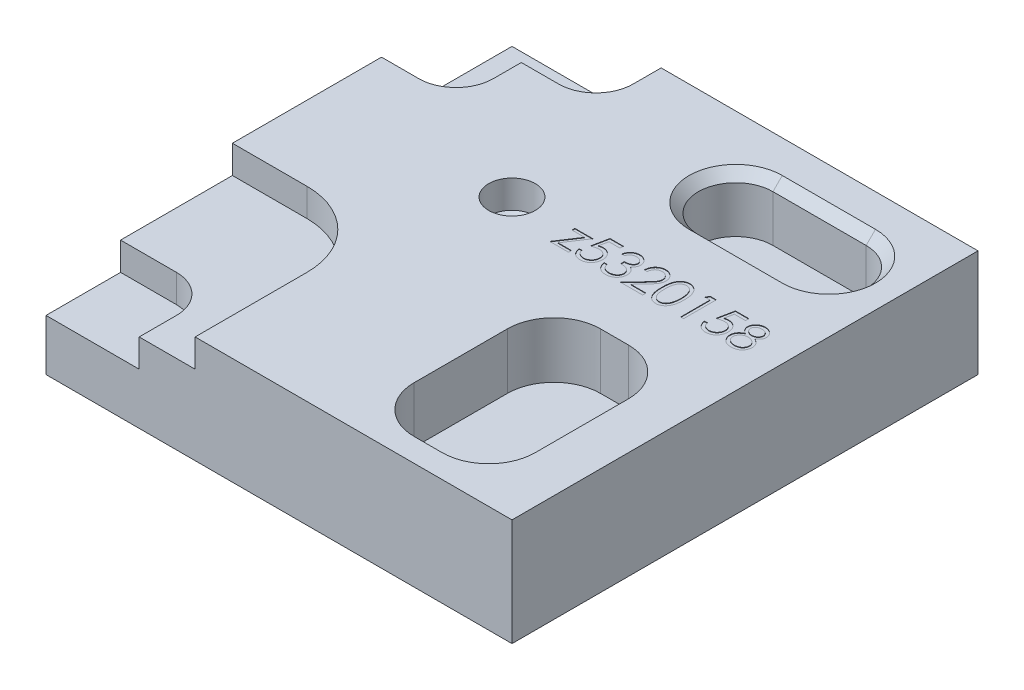
from build123d import *

# Parameters (mm, degrees)
SKETCH1_W                       = 50
SKETCH1_H                       = 50
BOSS_EXTRUDE1_DEPTH             = 11.5
CUT_EXTRUDE1_DEPTH              = 3
CUT_EXTRUDE4_DEPTH              = 43.99702731
CUT_EXTRUDE4_DEPTH_BACK         = 3
CUT_EXTRUDE5_DEPTH              = 6
CUT_EXTRUDE8_DEPTH              = 6
CUT_EXTRUDE11_DEPTH             = 44.689178952
CUT_EXTRUDE11_DEPTH_BACK        = 6
CHAMFER1_SIZE                   = 1
F_3_0MM_DOWEL_HOLE1_D           = 3
F_3_0MM_DOWEL_HOLE1_DEPTH       = 6
F_3_0MM_DOWEL_HOLE1_CSINK_D     = 3.05
F_3_0MM_DOWEL_HOLE1_CSINK_ANGLE = 90
F_3_0MM_DOWEL_HOLE1_TIP         = 0.901290929
F_5_0MM_DOWEL_HOLE1_D           = 5
F_5_0MM_DOWEL_HOLE1_DEPTH       = 3
F_5_0MM_DOWEL_HOLE1_TIP         = 1.502151548
ENGRAVE_CUT_DEPTH               = 0.05


with BuildPart() as part:
    # Sketch1 → Boss-Extrude1 (new body)
    with BuildSketch(Plane(origin=(0, 0, 0), x_dir=(1, 0, 0), z_dir=(0, 1, 0))):
        with Locations((4.357016401, -5.243345475)):
            Rectangle(SKETCH1_W, SKETCH1_H)
    extrude(amount=BOSS_EXTRUDE1_DEPTH)

    # Sketch3 → Cut-Extrude1 (cut)
    with BuildSketch(Plane(origin=(0, 11.5, 0), x_dir=(1, 0, 0), z_dir=(0, 1, 0))):
        with BuildLine():
            Line((-20.642983599, -10.243345475), (-12.642983599, -10.243345475))
            ThreePointArc((-12.642983599, -10.243345475), (-6.986129349, -12.586491226), (-4.642983599, -18.243345475))
            Line((-4.642983599, -18.243345475), (-4.642983599, -30.243345475))
            Line((-4.642983599, -30.243345475), (-20.642983599, -30.243345475))
            Line((-20.642983599, -30.243345475), (-20.642983599, -10.243345475))
        make_face()
    extrude(amount=-CUT_EXTRUDE1_DEPTH, mode=Mode.SUBTRACT)

    # Sketch7 → Cut-Extrude4 (cut, two sides: drawn at the far end of the back side and taken through both)
    with BuildSketch(Plane(origin=(0, 8.5, 0), x_dir=(1, 0, 0), z_dir=(0, 1, 0)).offset(-CUT_EXTRUDE4_DEPTH_BACK)):
        with BuildLine():
            Line((-161.241605337, -22.243345475), (-20.642983599, -22.243345475))
            Line((-20.642983599, -22.243345475), (-14.642983599, -22.243345475))
            ThreePointArc((-14.642983599, -22.243345475), (-11.814556474, -23.41491835), (-10.642983599, -26.243345475))
            Line((-10.642983599, -26.243345475), (-10.642983599, -30.243345475))
            Line((-10.642983599, -30.243345475), (-10.642983599, -170.841967214))
            Line((-10.642983599, -170.841967214), (-208.145915739, -371.003106137))
            Line((-208.145915739, -371.003106137), (-358.744537477, -222.404484399))
            Line((-358.744537477, -222.404484399), (-161.241605337, -22.243345475))
        make_face()
    extrude(amount=CUT_EXTRUDE4_DEPTH + CUT_EXTRUDE4_DEPTH_BACK, mode=Mode.SUBTRACT)

    # Sketch8 → Cut-Extrude5 (cut)
    with BuildSketch(Plane(origin=(0, 11.5, 0), x_dir=(1, 0, 0), z_dir=(0, 1, 0))):
        with BuildLine():
            Line((16.357016401, -7.743345475), (19.357016401, -7.743345475))
            ThreePointArc((19.357016401, -7.743345475), (22.892550307, -9.207811569), (24.357016401, -12.743345475))
            Line((24.357016401, -12.743345475), (24.357016401, -22.743345475))
            ThreePointArc((24.357016401, -22.743345475), (22.892550307, -26.278879381), (19.357016401, -27.743345475))
            Line((19.357016401, -27.743345475), (16.357016401, -27.743345475))
            ThreePointArc((16.357016401, -27.743345475), (12.821482495, -26.278879381), (11.357016401, -22.743345475))
            Line((11.357016401, -22.743345475), (11.357016401, -12.743345475))
            ThreePointArc((11.357016401, -12.743345475), (12.821482495, -9.207811569), (16.357016401, -7.743345475))
        make_face()
    extrude(amount=-CUT_EXTRUDE5_DEPTH, mode=Mode.SUBTRACT)

    # Sketch11 → Cut-Extrude8 (cut)
    with BuildSketch(Plane(origin=(0, 11.5, 0), x_dir=(1, 0, 0), z_dir=(0, 1, 0))):
        with BuildLine():
            Line((11.857016401, 15.256654525), (21.857016401, 15.256654525))
            ThreePointArc((21.857016401, 15.256654525), (25.857016401, 11.256654525), (21.857016401, 7.256654525))
            Line((21.857016401, 7.256654525), (11.857016401, 7.256654525))
            ThreePointArc((11.857016401, 7.256654525), (7.857016401, 11.256654525), (11.857016401, 15.256654525))
        make_face()
    extrude(amount=-CUT_EXTRUDE8_DEPTH, mode=Mode.SUBTRACT)

    # Sketch12 → Cut-Extrude11 (cut, two sides: drawn at the far end of the back side and taken through both)
    with BuildSketch(Plane(origin=(0, 11.5, 0), x_dir=(1, 0, 0), z_dir=(0, 1, 0)).offset(-CUT_EXTRUDE11_DEPTH_BACK)):
        with BuildLine():
            Line((-153.866358005, 5.756654525), (-20.642983599, 5.756654525))
            Line((-20.642983599, 5.756654525), (-16.642983599, 5.756654525))
            ThreePointArc((-16.642983599, 5.756654525), (-13.814556474, 6.9282274), (-12.642983599, 9.756654525))
            Line((-12.642983599, 9.756654525), (-12.642983599, 12.756654525))
            Line((-12.642983599, 12.756654525), (-8.642983599, 12.756654525))
            ThreePointArc((-8.642983599, 12.756654525), (-5.814556474, 13.9282274), (-4.642983599, 16.756654525))
            Line((-4.642983599, 16.756654525), (-4.642983599, 19.756654525))
            Line((-4.642983599, 19.756654525), (-4.642983599, 152.980028931))
            Line((-4.642983599, 152.980028931), (-191.773930696, 342.653112395))
            Line((-191.773930696, 342.653112395), (-340.997305102, 195.429737989))
            Line((-340.997305102, 195.429737989), (-153.866358005, 5.756654525))
        make_face()
    extrude(amount=CUT_EXTRUDE11_DEPTH + CUT_EXTRUDE11_DEPTH_BACK, mode=Mode.SUBTRACT)

    # Chamfer1
    chamfer1_edges = [part.edges().sort_by_distance(p)[0] for p in [
        (7.857016401, 11.5, -11.256654525),
        (16.857016401, 11.5, -7.256654525),
        (25.857016401, 11.5, -11.256654525),
        (16.857016401, 11.5, -15.256654525),
    ]]
    chamfer(chamfer1_edges, length=CHAMFER1_SIZE)

    # Ø3.0mm Dowel Hole1
    with Locations(Plane(origin=(-0.642983599, 11.5, 0.243345475), x_dir=(0, 0, 1), z_dir=(0, 1, 0))):
        with Locations((0, 0)):
            CounterSinkHole(F_3_0MM_DOWEL_HOLE1_D / 2, F_3_0MM_DOWEL_HOLE1_CSINK_D / 2, depth=F_3_0MM_DOWEL_HOLE1_DEPTH, counter_sink_angle=F_3_0MM_DOWEL_HOLE1_CSINK_ANGLE)
            with Locations((0, 0, -(F_3_0MM_DOWEL_HOLE1_DEPTH + F_3_0MM_DOWEL_HOLE1_TIP / 2))):  # 118° drill point
                Cone(0, F_3_0MM_DOWEL_HOLE1_D / 2, F_3_0MM_DOWEL_HOLE1_TIP, mode=Mode.SUBTRACT)

    # Ø5.0mm Dowel Hole1
    with Locations(Plane(origin=(-0.642983599, 11.5, 0.243345475), x_dir=(0, 0, 1), z_dir=(0, 1, 0))):
        with Locations((0, 0)):
            Hole(F_5_0MM_DOWEL_HOLE1_D / 2, depth=F_5_0MM_DOWEL_HOLE1_DEPTH)
            with Locations((0, 0, -(F_5_0MM_DOWEL_HOLE1_DEPTH + F_5_0MM_DOWEL_HOLE1_TIP / 2))):  # 118° drill point
                Cone(0, F_5_0MM_DOWEL_HOLE1_D / 2, F_5_0MM_DOWEL_HOLE1_TIP, mode=Mode.SUBTRACT)

    # Engrave → Engrave cut (cut)
    # profile 1 of 8: a face of its own
    with BuildSketch(Plane(origin=(0, 11.5, 0), x_dir=(1, 0, 0), z_dir=(0, 1, 0))):
        Polygon((5.641411131, 0.217706349), (7.570898311, 0.217706349), (6.083117862, -2.025883395), (7.526026516, -2.025883395), (7.526026516, -2.339985959), (5.506795747, -2.339985959), (6.995277317, -0.096396215), (5.641411131, -0.096396215), align=None)
    # profile 2 of 8: a face of its own
    with BuildSketch(Plane(origin=(0, 11.5, 0), x_dir=(1, 0, 0), z_dir=(0, 1, 0))):
        with BuildLine():
            Line((9.904231644, 1.160014041), (9.904231644, 0.801039682))
            Line((9.904231644, 0.801039682), (8.713726837, 0.801039682))
            Line((8.713726837, 0.801039682), (8.525125074, -0.119533234))
            add(Edge.make_bspline(
                [(8.525125074, -0.119533234), (8.562180948, -0.109302963), (8.633970844, -0.089483429), (8.739930705, -0.067477659), (8.840522908, -0.054212214), (8.905798279, -0.052400904), (8.937384689, -0.05152442)],
                knots=[0, 0, 0, 0, 1.100273476, 2.13160584, 3.095893838, 4, 4, 4, 4], degree=3))
            add(Edge.make_bspline(
                [(8.937384689, -0.05152442), (8.976468429, -0.052370356), (9.053316826, -0.054033677), (9.165755773, -0.070005526), (9.273088666, -0.095145441), (9.375091037, -0.130265963), (9.471951587, -0.175175696), (9.562779149, -0.231275636), (9.648937062, -0.296808967), (9.728879656, -0.372153979), (9.801403964, -0.455075596), (9.865169953, -0.544233467), (9.919332544, -0.638761129), (9.962893299, -0.739561738), (9.997677633, -0.845520891), (10.020829628, -0.957753474), (10.036246337, -1.075201594), (10.037968723, -1.155506164), (10.038847029, -1.196456311)],
                knots=[0, 0, 0, 0, 1.052922333, 2.070308379, 3.05430497, 4.020497103, 4.973039431, 5.925935799, 6.892292201, 7.88610001, 8.88166317, 9.857072816, 10.836096531, 11.812156883, 12.81219415, 13.836441305, 14.89672472, 16, 16, 16, 16], degree=3))
            add(Edge.make_bspline(
                [(10.038847029, -1.196456311), (10.038181954, -1.224978532), (10.036860791, -1.281637519), (10.030142203, -1.36578172), (10.017206487, -1.448144553), (9.999838763, -1.528736945), (9.977296345, -1.607406317), (9.950007291, -1.684377845), (9.916611264, -1.759172452), (9.879979888, -1.832497847), (9.83873341, -1.902696354), (9.792954903, -1.96834534), (9.744589412, -2.030429622), (9.692548026, -2.088283355), (9.636347031, -2.141526373), (9.576667064, -2.190474654), (9.513984345, -2.235955985), (9.447329103, -2.27612418), (9.37818662, -2.313087136), (9.305558403, -2.343410673), (9.231097703, -2.370521201), (9.153732827, -2.392130729), (9.073639014, -2.409063284), (8.990684239, -2.420563884), (8.905303569, -2.428940322), (8.847428556, -2.429464679), (8.818193984, -2.429729548)],
                knots=[0, 0, 0, 0, 1.056347294, 2.098418968, 3.122841568, 4.141288669, 5.149314143, 6.15115421, 7.162517403, 8.180376062, 9.185164535, 10.17417709, 11.141909838, 12.097768115, 13.052685741, 14.0056014, 14.954263652, 15.917497458, 16.885230207, 17.854509472, 18.828990115, 19.81800267, 20.826176721, 21.857883937, 22.917946725, 24, 24, 24, 24], degree=3))
            add(Edge.make_bspline(
                [(8.818193984, -2.429729548), (8.783319803, -2.429038711), (8.714708973, -2.427679568), (8.614188406, -2.413461083), (8.5174738, -2.393097167), (8.425343699, -2.362460897), (8.336972435, -2.324073602), (8.253549717, -2.275557431), (8.172943941, -2.220578327), (8.098431904, -2.155697974), (8.029275791, -2.084782292), (7.967369282, -2.007824651), (7.912235705, -1.926095209), (7.864757958, -1.839197055), (7.824259937, -1.747358524), (7.792444949, -1.650235523), (7.766766594, -1.548335519), (7.755903173, -1.478182008), (7.75038549, -1.442550061)],
                knots=[0, 0, 0, 0, 1.0467383, 2.05933395, 3.04377827, 4.011590433, 4.970194871, 5.932262533, 6.905835911, 7.896367577, 8.894135286, 9.877477877, 10.858688626, 11.851381753, 12.8477658, 13.868841284, 14.917554742, 16, 16, 16, 16], degree=3))
            Line((7.75038549, -1.442550061), (8.064488054, -1.442550061))
            add(Edge.make_bspline(
                [(8.064488054, -1.442550061), (8.072216612, -1.475926514), (8.087071328, -1.540077909), (8.119677077, -1.63020925), (8.159542953, -1.710528474), (8.206947301, -1.782098057), (8.263497331, -1.844507054), (8.32802676, -1.900124116), (8.400374484, -1.950299245), (8.480767713, -1.992122013), (8.565580792, -2.027790766), (8.654348002, -2.051542461), (8.744652349, -2.068243354), (8.805730719, -2.069915115), (8.836423151, -2.07075519)],
                knots=[0, 0, 0, 0, 1.136247022, 2.183929868, 3.172523383, 4.106158343, 5.02341133, 5.958108904, 6.928429099, 7.938127109, 8.96079061, 9.975095812, 10.982467395, 12, 12, 12, 12], degree=3))
            add(Edge.make_bspline(
                [(8.836423151, -2.07075519), (8.866381595, -2.069934412), (8.925370017, -2.068318293), (9.012181404, -2.055879281), (9.095994278, -2.03672171), (9.175981635, -2.008051855), (9.253543174, -1.973207136), (9.326716945, -1.928492061), (9.397619822, -1.877032042), (9.464047956, -1.818075412), (9.524887405, -1.753105717), (9.578643526, -1.683628324), (9.623420439, -1.609511477), (9.661154548, -1.532038325), (9.689807847, -1.450359767), (9.710248828, -1.364858592), (9.722251887, -1.275323612), (9.723903067, -1.214254302), (9.724744465, -1.183134997)],
                knots=[0, 0, 0, 0, 1.027316725, 2.022795036, 3.002884548, 3.971462791, 4.93288096, 5.914575861, 6.907176829, 7.935150275, 8.956128384, 9.956726525, 10.942570165, 11.921478529, 12.907843606, 13.90538589, 14.932640048, 16, 16, 16, 16], degree=3))
            add(Edge.make_bspline(
                [(9.724744465, -1.183134997), (9.724085985, -1.155059246), (9.722797105, -1.100104957), (9.712266535, -1.01970575), (9.693949563, -0.943632708), (9.668525683, -0.871518474), (9.636246175, -0.803295031), (9.596799863, -0.738891971), (9.549446465, -0.679158138), (9.495354576, -0.624065584), (9.436096535, -0.57322071), (9.370652793, -0.529876623), (9.300392866, -0.493412705), (9.226163266, -0.461944707), (9.146198368, -0.439343962), (9.062081735, -0.422376076), (8.972905028, -0.412560714), (8.911934339, -0.411198825), (8.880593824, -0.410498779)],
                knots=[0, 0, 0, 0, 1.045622112, 2.046656509, 3.013763289, 3.955457236, 4.890082067, 5.820317437, 6.762574623, 7.722996705, 8.69280354, 9.665887285, 10.63943826, 11.638615906, 12.663482002, 13.728887084, 14.832589034, 16, 16, 16, 16], degree=3))
            add(Edge.make_bspline(
                [(8.880593824, -0.410498779), (8.853464895, -0.41107937), (8.79745054, -0.412278144), (8.711527713, -0.421104641), (8.62123599, -0.435343935), (8.526921494, -0.454930183), (8.428300986, -0.480561259), (8.325582585, -0.51127576), (8.218550319, -0.547997759), (8.146432594, -0.575729972), (8.109359849, -0.589985959)],
                knots=[0, 0, 0, 0, 0.817624296, 1.688186739, 2.600797293, 3.572016777, 4.590301741, 5.671205678, 6.80286297, 8, 8, 8, 8], degree=3))
            Line((8.109359849, -0.589985959), (8.468334208, 1.160014041))
            Line((8.468334208, 1.160014041), (9.904231644, 1.160014041))
        make_face()
    # profile 3 of 8: a face of its own
    with BuildSketch(Plane(origin=(0, 11.5, 0), x_dir=(1, 0, 0), z_dir=(0, 1, 0))):
        with BuildLine():
            Line((10.846539337, 0.352321734), (10.532436772, 0.352321734))
            add(Edge.make_bspline(
                [(10.532436772, 0.352321734), (10.540946323, 0.387554218), (10.557581799, 0.456430842), (10.592279372, 0.554838103), (10.630078627, 0.647961624), (10.675467732, 0.734057698), (10.724976486, 0.814856601), (10.781699208, 0.888525725), (10.84301893, 0.956938691), (10.91084388, 1.017651928), (10.981972541, 1.072629657), (11.057407161, 1.119504715), (11.135630055, 1.159828868), (11.217183188, 1.193049099), (11.302309359, 1.218074623), (11.390238983, 1.236231429), (11.481202483, 1.248022543), (11.542950073, 1.249173306), (11.57430376, 1.249757631)],
                knots=[0, 0, 0, 0, 1.162005537, 2.271625781, 3.343758855, 4.383309926, 5.390229558, 6.379919256, 7.361854164, 8.333198761, 9.295911338, 10.242430842, 11.177959212, 12.116337295, 13.062827104, 14.020064771, 14.994644689, 16, 16, 16, 16], degree=3))
            add(Edge.make_bspline(
                [(11.57430376, 1.249757631), (11.619986502, 1.248378401), (11.710355513, 1.245650025), (11.84311856, 1.220735589), (11.971145379, 1.181310456), (12.093034627, 1.126836729), (12.206253059, 1.059649416), (12.306989246, 0.979684679), (12.393877757, 0.888485378), (12.466772134, 0.787752813), (12.523847133, 0.680097304), (12.565933507, 0.569297147), (12.591555188, 0.455615176), (12.594875745, 0.378857896), (12.596539337, 0.340402663)],
                knots=[0, 0, 0, 0, 1.083050992, 2.142477498, 3.193116406, 4.255571735, 5.30263384, 6.308962982, 7.297363603, 8.282367274, 9.249857812, 10.179914175, 11.08814088, 12, 12, 12, 12], degree=3))
            add(Edge.make_bspline(
                [(12.596539337, 0.340402663), (12.595375745, 0.303395868), (12.593098778, 0.230979314), (12.573765073, 0.125257817), (12.54122881, 0.025616216), (12.496159047, -0.068364946), (12.437817497, -0.156089785), (12.3671448, -0.237755676), (12.283642138, -0.313724834), (12.2203632, -0.357244307), (12.18778533, -0.37964942)],
                knots=[0, 0, 0, 0, 1.024540389, 2.004866551, 2.965041327, 3.920577974, 4.882998113, 5.874504559, 6.905732034, 8, 8, 8, 8], degree=3))
            add(Edge.make_bspline(
                [(12.18778533, -0.37964942), (12.225017085, -0.397627592), (12.298783959, -0.433247549), (12.399334489, -0.503103307), (12.490612364, -0.583759654), (12.541516083, -0.646702307), (12.567092221, -0.678327305)],
                knots=[0, 0, 0, 0, 1.015518401, 2.012035669, 3.001164323, 4, 4, 4, 4], degree=3))
            add(Edge.make_bspline(
                [(12.567092221, -0.678327305), (12.583933564, -0.701385057), (12.61734046, -0.747122973), (12.658575993, -0.820659399), (12.695985108, -0.895010888), (12.725135327, -0.972170294), (12.747709194, -1.051243308), (12.763845226, -1.132365704), (12.773869367, -1.215603726), (12.775304919, -1.271916207), (12.776026516, -1.300222337)],
                knots=[0, 0, 0, 0, 1.025084078, 2.033381695, 3.024893161, 4.013698104, 4.991890475, 5.976764909, 6.982997093, 8, 8, 8, 8], degree=3))
            add(Edge.make_bspline(
                [(12.776026516, -1.300222337), (12.774232003, -1.349232058), (12.77065142, -1.44702086), (12.738647346, -1.591495582), (12.689034105, -1.732721084), (12.61857717, -1.867795923), (12.532709661, -1.994176304), (12.430552337, -2.107252613), (12.313265928, -2.204451218), (12.182460279, -2.285661446), (12.040743151, -2.350579368), (11.889167559, -2.395636811), (11.729917505, -2.42498281), (11.620710207, -2.428129679), (11.565189176, -2.429729548)],
                knots=[0, 0, 0, 0, 0.955779014, 1.907060117, 2.875433937, 3.871313158, 4.872415639, 5.851225146, 6.836215519, 7.83643374, 8.849228613, 9.86973379, 10.916971861, 12, 12, 12, 12], degree=3))
            add(Edge.make_bspline(
                [(11.565189176, -2.429729548), (11.527769876, -2.428861335), (11.454141171, -2.427152981), (11.345897673, -2.41547438), (11.242575973, -2.394144375), (11.144036375, -2.365441069), (11.050191339, -2.329049327), (10.961327234, -2.283730629), (10.87689734, -2.230419127), (10.797698389, -2.168485539), (10.723739821, -2.0992042), (10.656987097, -2.02134519), (10.596327304, -1.936347786), (10.543384665, -1.843224729), (10.495747713, -1.743179472), (10.456566756, -1.634930974), (10.422081188, -1.519446952), (10.406047723, -1.438969212), (10.397821388, -1.397678266)],
                knots=[0, 0, 0, 0, 1.048658725, 2.063410685, 3.046034179, 4.001477787, 4.936774919, 5.862367409, 6.792675028, 7.730719943, 8.675894397, 9.627829632, 10.600096036, 11.597688215, 12.626045268, 13.701542398, 14.82072376, 16, 16, 16, 16], degree=3))
            Line((10.397821388, -1.397678266), (10.711923952, -1.397678266))
            add(Edge.make_bspline(
                [(10.711923952, -1.397678266), (10.720107243, -1.42462728), (10.736024456, -1.477045451), (10.763118754, -1.552485757), (10.793987026, -1.62164381), (10.827101585, -1.685026932), (10.861880031, -1.743259335), (10.900794956, -1.794801204), (10.940964101, -1.841916406), (10.971243454, -1.868461018), (10.986062574, -1.881452305)],
                knots=[0, 0, 0, 0, 1.198163088, 2.33053128, 3.407730985, 4.417276592, 5.372219308, 6.28897303, 7.162600585, 8, 8, 8, 8], degree=3))
            add(Edge.make_bspline(
                [(10.986062574, -1.881452305), (11.00565915, -1.896560639), (11.044791813, -1.926730671), (11.108560044, -1.965232299), (11.17562493, -1.998593324), (11.247439605, -2.02407702), (11.322454375, -2.045654681), (11.40188174, -2.0597752), (11.485020957, -2.069463371), (11.541788721, -2.070318303), (11.570798151, -2.07075519)],
                knots=[0, 0, 0, 0, 0.946170439, 1.889420265, 2.845303464, 3.807233317, 4.801018734, 5.828864929, 6.890507805, 8, 8, 8, 8], degree=3))
            add(Edge.make_bspline(
                [(11.570798151, -2.07075519), (11.603551653, -2.070139284), (11.6675983, -2.068934935), (11.76105316, -2.057859228), (11.849960607, -2.041728814), (11.933333533, -2.016815832), (12.01226404, -1.98603498), (12.08564569, -1.947386575), (12.154441796, -1.902041853), (12.217771201, -1.850502694), (12.274716709, -1.794081199), (12.324856222, -1.735068128), (12.367480884, -1.673712299), (12.401864462, -1.609674178), (12.429015012, -1.543218949), (12.447498213, -1.47416012), (12.460349728, -1.403062853), (12.46139634, -1.354733884), (12.461923952, -1.330370574)],
                knots=[0, 0, 0, 0, 1.217147791, 2.380027433, 3.494444702, 4.572153297, 5.609568379, 6.639424714, 7.649109417, 8.668170816, 9.669597737, 10.625200337, 11.543417969, 12.441394052, 13.322311151, 14.205496177, 15.095365482, 16, 16, 16, 16], degree=3))
            add(Edge.make_bspline(
                [(12.461923952, -1.330370574), (12.46039365, -1.297759235), (12.457340662, -1.232698827), (12.434032082, -1.136981253), (12.395693218, -1.04475784), (12.342020707, -0.95760205), (12.276684978, -0.876826149), (12.200320071, -0.804754666), (12.112291843, -0.745284575), (12.031271974, -0.704195919), (11.959506818, -0.676158844), (11.898091433, -0.657483879), (11.82933483, -0.641670223), (11.754068481, -0.626957952), (11.671725264, -0.614436604), (11.582394826, -0.603994788), (11.486059065, -0.595639747), (11.419367899, -0.591908652), (11.385000875, -0.589985959)],
                knots=[0, 0, 0, 0, 1.07054697, 2.135767047, 3.216561865, 4.33974944, 5.486079747, 6.621378074, 7.775625952, 8.963672916, 9.598146892, 10.304877434, 11.070270905, 11.915000392, 12.823868403, 13.805723172, 14.86925407, 16, 16, 16, 16], degree=3))
            Line((11.385000875, -0.589985959), (11.385000875, -0.2310116))
            add(Edge.make_bspline(
                [(11.385000875, -0.2310116), (11.428302041, -0.230276796), (11.513118387, -0.228837496), (11.637012692, -0.211429486), (11.755486004, -0.187348858), (11.865912746, -0.150463665), (11.96656146, -0.107623368), (12.053881062, -0.057771159), (12.126648209, -0.00235641), (12.18450928, 0.0594762), (12.228038509, 0.125791247), (12.259865306, 0.194907905), (12.278665633, 0.267431966), (12.2811753, 0.316926634), (12.282436772, 0.341804907)],
                knots=[0, 0, 0, 0, 1.321986639, 2.589447074, 3.816329219, 5.01088745, 6.139805852, 7.153945165, 8.075214402, 8.924034688, 9.728124013, 10.488707548, 11.240355623, 12, 12, 12, 12], degree=3))
            add(Edge.make_bspline(
                [(12.282436772, 0.341804907), (12.282022361, 0.360082652), (12.281197911, 0.396445359), (12.270800633, 0.449570428), (12.255176592, 0.501071373), (12.233696862, 0.550729184), (12.204946664, 0.598199458), (12.170540677, 0.643886907), (12.129572577, 0.687530686), (12.08262713, 0.728211005), (12.032215325, 0.766980242), (11.97696555, 0.799893879), (11.918543675, 0.828038941), (11.85688502, 0.851248443), (11.79178949, 0.868707732), (11.723562932, 0.881243573), (11.652075249, 0.889081228), (11.603303517, 0.890209644), (11.57851049, 0.890783272)],
                knots=[0, 0, 0, 0, 0.884392785, 1.759457502, 2.611959086, 3.489218968, 4.37281399, 5.2945488, 6.255912374, 7.266815255, 8.301784654, 9.332968512, 10.37626691, 11.440494194, 12.520033166, 13.637162961, 14.798855837, 16, 16, 16, 16], degree=3))
            add(Edge.make_bspline(
                [(11.57851049, 0.890783272), (11.538658822, 0.88939191), (11.460819246, 0.886674256), (11.348604329, 0.862871243), (11.244284995, 0.824893159), (11.164546329, 0.77956014), (11.105663754, 0.734809706), (11.063586816, 0.69572732), (11.022266306, 0.652294496), (10.984420629, 0.601836121), (10.946146652, 0.547769331), (10.911302091, 0.487345649), (10.877442398, 0.422141255), (10.857039849, 0.37604562), (10.846539337, 0.352321734)],
                knots=[0, 0, 0, 0, 1.472543308, 2.876219568, 4.221790263, 5.565193594, 6.249813518, 6.953379497, 7.687249741, 8.463570142, 9.283606569, 10.136032583, 11.040678096, 12, 12, 12, 12], degree=3))
        make_face()
    # profile 4 of 8: a face of its own
    with BuildSketch(Plane(origin=(0, 11.5, 0), x_dir=(1, 0, 0), z_dir=(0, 1, 0))):
        with BuildLine():
            Line((13.538847029, 0.083090964), (13.224744465, 0.083090964))
            add(Edge.make_bspline(
                [(13.224744465, 0.083090964), (13.226791618, 0.124761852), (13.230812172, 0.206602367), (13.249640461, 0.325926273), (13.276581338, 0.439981072), (13.314672792, 0.547850986), (13.36197907, 0.650489793), (13.418709097, 0.747489809), (13.485902948, 0.838480997), (13.562109682, 0.922619841), (13.644878321, 0.999807412), (13.73418426, 1.066462654), (13.828029288, 1.122780326), (13.926128687, 1.169861567), (14.02958925, 1.205201413), (14.137472108, 1.231423053), (14.250251245, 1.247199399), (14.327091267, 1.248895184), (14.366170747, 1.249757631)],
                knots=[0, 0, 0, 0, 1.10065271, 2.161652631, 3.183658789, 4.190468796, 5.17591951, 6.163126047, 7.15150782, 8.156236427, 9.156009102, 10.134482811, 11.092018607, 12.041330605, 13.001268258, 13.972401359, 14.968799086, 16, 16, 16, 16], degree=3))
            add(Edge.make_bspline(
                [(14.366170747, 1.249757631), (14.404548821, 1.248859175), (14.479960366, 1.24709374), (14.59002238, 1.23193271), (14.694799674, 1.208187119), (14.794087441, 1.174871703), (14.887093506, 1.130087275), (14.97451655, 1.076289736), (15.057397361, 1.014069905), (15.132004145, 0.940816092), (15.200512224, 0.862613707), (15.259614479, 0.779125804), (15.310227642, 0.692896518), (15.352415322, 0.603268316), (15.383471461, 0.509397288), (15.407049669, 0.412650085), (15.420377083, 0.312025274), (15.422422506, 0.243918718), (15.423462413, 0.209292887)],
                knots=[0, 0, 0, 0, 1.111607364, 2.184268762, 3.212621178, 4.221274766, 5.211760367, 6.196651075, 7.1921475, 8.207485113, 9.220403448, 10.201281604, 11.166441695, 12.114753415, 13.065576456, 14.026450734, 14.996634279, 16, 16, 16, 16], degree=3))
            add(Edge.make_bspline(
                [(15.423462413, 0.209292887), (15.421769151, 0.160545053), (15.418412339, 0.063904839), (15.389697963, -0.078110024), (15.344851452, -0.215703443), (15.290854095, -0.326440745), (15.236381651, -0.415674239), (15.187294143, -0.489142943), (15.129829332, -0.568248412), (15.063150834, -0.652725749), (14.988637962, -0.743236654), (14.905615799, -0.83972645), (14.813492317, -0.94119822), (14.748833816, -1.010503821), (14.715329401, -1.046416247)],
                knots=[0, 0, 0, 0, 1.184426356, 2.348067706, 3.509069118, 4.696110526, 5.333549288, 6.050745305, 6.844228056, 7.710549037, 8.667450064, 9.695053472, 10.805634456, 12, 12, 12, 12], degree=3))
            Line((14.715329401, -1.046416247), (13.839628279, -1.9810116))
            Line((13.839628279, -1.9810116), (15.468334208, -1.9810116))
            Line((15.468334208, -1.9810116), (15.468334208, -2.339985959))
            Line((15.468334208, -2.339985959), (13.09012908, -2.339985959))
            Line((13.09012908, -2.339985959), (14.447500875, -0.891468331))
            add(Edge.make_bspline(
                [(14.447500875, -0.891468331), (14.480548762, -0.856970024), (14.544026989, -0.790705837), (14.633809566, -0.693962877), (14.714448554, -0.604213336), (14.786465947, -0.521626788), (14.848299452, -0.44499522), (14.903171684, -0.376800517), (14.947137275, -0.314046066), (14.994852671, -0.241305452), (15.041066652, -0.152493135), (15.080779008, -0.043959446), (15.104993857, 0.067767807), (15.107898692, 0.143269844), (15.109359849, 0.181248016)],
                knots=[0, 0, 0, 0, 1.329631726, 2.553950428, 3.673215718, 4.687767853, 5.603093632, 6.413772471, 7.123043292, 7.734684054, 8.834405432, 9.900288307, 10.943827018, 12, 12, 12, 12], degree=3))
            add(Edge.make_bspline(
                [(15.109359849, 0.181248016), (15.108724107, 0.205129414), (15.107471181, 0.252195064), (15.096413484, 0.321200823), (15.079702977, 0.387765637), (15.055757719, 0.452094256), (15.024150979, 0.513539908), (14.985677599, 0.572177389), (14.941287536, 0.628866354), (14.889936267, 0.682019652), (14.833524747, 0.730700857), (14.773930497, 0.773824943), (14.710880393, 0.809864054), (14.644640271, 0.839407551), (14.575394801, 0.862582932), (14.503010056, 0.878641511), (14.42768604, 0.888723995), (14.376252544, 0.890088167), (14.350044946, 0.890783272)],
                knots=[0, 0, 0, 0, 0.991446411, 1.95395049, 2.89581595, 3.838931463, 4.798493298, 5.75982156, 6.748411868, 7.785213223, 8.824556874, 9.840280684, 10.836137867, 11.835679398, 12.848801643, 13.863922112, 14.911575587, 16, 16, 16, 16], degree=3))
            add(Edge.make_bspline(
                [(14.350044946, 0.890783272), (14.322674113, 0.89006824), (14.268922317, 0.888664034), (14.190003284, 0.87884137), (14.114717506, 0.86189553), (14.042875603, 0.838718856), (13.974356017, 0.809260307), (13.909491973, 0.772568562), (13.848429084, 0.728785069), (13.791052561, 0.679144513), (13.738188582, 0.623876911), (13.691741706, 0.562266948), (13.651157692, 0.495439533), (13.615748458, 0.423574982), (13.586992768, 0.346021202), (13.565019618, 0.263053498), (13.547632771, 0.175032116), (13.54182425, 0.114247031), (13.538847029, 0.083090964)],
                knots=[0, 0, 0, 0, 1.031018746, 2.02475058, 2.990194455, 3.934040569, 4.864654155, 5.795059489, 6.735614925, 7.690564532, 8.649604399, 9.611025574, 10.590972636, 11.591080095, 12.624614302, 13.701020113, 14.821632451, 16, 16, 16, 16], degree=3))
        make_face()
    # profile 5 of 8: a face of its own
    with BuildSketch(Plane(origin=(0, 11.5, 0), x_dir=(1, 0, 0), z_dir=(0, 1, 0))):
        with BuildLine():
            add(Edge.make_bspline(
                [(15.782436772, -0.591388202), (15.782764791, -0.535290815), (15.783401971, -0.42632083), (15.790490392, -0.267536188), (15.802265734, -0.118575899), (15.818403107, 0.020567167), (15.838041087, 0.149928931), (15.864256574, 0.269163688), (15.894069376, 0.378823295), (15.928621822, 0.479265343), (15.967609611, 0.571843047), (16.010043872, 0.658268248), (16.057608666, 0.73841018), (16.107585579, 0.813547971), (16.161997651, 0.882451665), (16.219296441, 0.946094328), (16.281718317, 1.003005078), (16.347141326, 1.054851381), (16.41615779, 1.100300852), (16.486800456, 1.140333591), (16.559555562, 1.174533458), (16.634621745, 1.201423894), (16.711324303, 1.223634741), (16.78993137, 1.238823689), (16.870572733, 1.248380597), (16.925004168, 1.249294265), (16.952609048, 1.249757631)],
                knots=[0, 0, 0, 0, 1.646270934, 3.197905019, 4.663502075, 6.030701355, 7.308322542, 8.50163776, 9.611534131, 10.641858119, 11.616356847, 12.558055219, 13.465016945, 14.349605745, 15.204443733, 16.039544428, 16.859896111, 17.680448484, 18.487036065, 19.28249412, 20.06191084, 20.843045899, 21.620316918, 22.403196591, 23.190181807, 24, 24, 24, 24], degree=3))
            add(Edge.make_bspline(
                [(16.952609048, 1.249757631), (16.980444527, 1.249269816), (17.035800535, 1.248299705), (17.117640911, 1.238975762), (17.197590592, 1.223504639), (17.275308731, 1.201583665), (17.351433718, 1.174387988), (17.425370125, 1.140300871), (17.497577207, 1.100622004), (17.566907494, 1.053998126), (17.63412211, 1.00201585), (17.697570073, 0.943253181), (17.757257159, 0.878303462), (17.813932464, 0.807861598), (17.865988061, 0.730576513), (17.915561493, 0.647792403), (17.959933529, 0.558061539), (18.002668205, 0.462881071), (18.039555191, 0.359617412), (18.072821437, 0.248852652), (18.099700405, 0.129278465), (18.122089677, 0.001522219), (18.139434573, -0.134885264), (18.152067215, -0.279651579), (18.158740301, -0.43287197), (18.159997002, -0.537629819), (18.160641901, -0.591388202)],
                knots=[0, 0, 0, 0, 0.810914788, 1.612654377, 2.396697861, 3.181598691, 3.963628158, 4.749916497, 5.551656086, 6.361998678, 7.18212741, 8.025565596, 8.878627764, 9.750805457, 10.657531673, 11.591944965, 12.560506719, 13.57287815, 14.630710178, 15.753379473, 16.941251878, 18.199788006, 19.531962791, 20.947069417, 22.433333509, 24, 24, 24, 24], degree=3))
            add(Edge.make_bspline(
                [(18.160641901, -0.591388202), (18.159990316, -0.64491211), (18.15872073, -0.749201262), (18.152142023, -0.901732237), (18.139183392, -1.045730281), (18.122973404, -1.181540743), (18.100522441, -1.308598362), (18.072917275, -1.427342811), (18.042266952, -1.538286882), (18.004432158, -1.640521694), (17.963021447, -1.735473417), (17.917966251, -1.824140565), (17.869696425, -1.907306858), (17.81710768, -1.984306605), (17.761054267, -2.055685262), (17.700336478, -2.120182884), (17.636665893, -2.179353556), (17.569253477, -2.232005184), (17.498841926, -2.278089988), (17.426882849, -2.319303839), (17.352099466, -2.352536534), (17.276186513, -2.381071575), (17.198058147, -2.402872027), (17.117811756, -2.417945882), (17.03585552, -2.428517731), (16.980453955, -2.429324211), (16.952609048, -2.429729548)],
                knots=[0, 0, 0, 0, 1.561518951, 3.042555995, 4.452378317, 5.7783523, 7.031515105, 8.214008947, 9.334062868, 10.386615937, 11.391082383, 12.354592575, 13.286541444, 14.194233754, 15.072674879, 15.931287219, 16.775624067, 17.606195743, 18.42308326, 19.229000347, 20.022332153, 20.807536673, 21.593273796, 22.3848459, 23.188221202, 24, 24, 24, 24], degree=3))
            add(Edge.make_bspline(
                [(16.952609048, -2.429729548), (16.925004934, -2.429263193), (16.870575009, -2.428343631), (16.789922584, -2.4188299), (16.71164014, -2.403534396), (16.635341386, -2.382117792), (16.560634871, -2.355902956), (16.488538585, -2.321749272), (16.418250901, -2.282415203), (16.349959345, -2.237619782), (16.284947184, -2.186298099), (16.222848579, -2.12953381), (16.16522356, -2.065910399), (16.111589464, -1.996432476), (16.060615376, -1.921739233), (16.013726002, -1.84081086), (15.970355148, -1.75396825), (15.930711658, -1.660650339), (15.895562994, -1.559495411), (15.864515286, -1.449346233), (15.840001129, -1.329230597), (15.819018173, -1.20011323), (15.80209379, -1.061439299), (15.790539465, -0.913133521), (15.78339815, -0.755288312), (15.782763079, -0.647018538), (15.782436772, -0.591388202)],
                knots=[0, 0, 0, 0, 0.810891512, 1.598919785, 2.382837074, 3.152667961, 3.926044502, 4.706494248, 5.493654104, 6.291793342, 7.103789334, 7.925228297, 8.761435821, 9.622817696, 10.50288917, 11.416980706, 12.369136599, 13.353924996, 14.394355917, 15.514179734, 16.714354668, 17.994756427, 19.357759367, 20.818452758, 22.365282078, 24, 24, 24, 24], degree=3))
        make_face()
        with BuildLine():
            add(Edge.make_bspline(
                [(16.096539337, -0.589985959), (16.096658784, -0.636734658), (16.096890607, -0.727464702), (16.102946807, -0.859307963), (16.111197039, -0.982278292), (16.121838337, -1.096531829), (16.137641285, -1.201681841), (16.155348073, -1.298451524), (16.176896163, -1.386328761), (16.202391181, -1.465916572), (16.231430277, -1.53856564), (16.263136141, -1.606166856), (16.297196864, -1.669518792), (16.335316015, -1.7280524), (16.376831078, -1.781958565), (16.420804337, -1.832191397), (16.468876921, -1.876988378), (16.535380664, -1.930715233), (16.623177138, -1.986234367), (16.733797593, -2.034580457), (16.847466044, -2.064962913), (16.924617294, -2.068826669), (16.963125875, -2.07075519)],
                knots=[0, 0, 0, 0, 1.459021318, 2.831673884, 4.118529203, 5.306027144, 6.411944654, 7.436330062, 8.375795394, 9.233974572, 10.042671642, 10.816086306, 11.563610507, 12.285937304, 12.993564865, 13.685989202, 14.367179055, 15.041617293, 16.353048772, 17.594441528, 18.799311195, 20, 20, 20, 20], degree=3))
            add(Edge.make_bspline(
                [(16.963125875, -2.07075519), (17.001883547, -2.069157409), (17.07931887, -2.065965146), (17.192452665, -2.035166409), (17.302282935, -1.988696869), (17.388354875, -1.933749364), (17.453837419, -1.881421034), (17.500754409, -1.836806386), (17.543816457, -1.786850519), (17.584658532, -1.732951223), (17.622117608, -1.674078738), (17.656180746, -1.610516163), (17.687264093, -1.542086985), (17.704973139, -1.494317246), (17.714027317, -1.469893811)],
                knots=[0, 0, 0, 0, 1.353760809, 2.704726607, 4.075137775, 5.516104923, 6.260822281, 7.007110065, 7.778089737, 8.566572457, 9.372053459, 10.217411131, 11.088608312, 12, 12, 12, 12], degree=3))
            add(Edge.make_bspline(
                [(17.714027317, -1.469893811), (17.724579085, -1.438664072), (17.746003699, -1.375254308), (17.773615473, -1.276890656), (17.795360872, -1.173687892), (17.814924238, -1.066262775), (17.828277294, -0.953823074), (17.839025107, -0.83671669), (17.845355794, -0.714855328), (17.846140545, -0.632060337), (17.846539337, -0.589985959)],
                knots=[0, 0, 0, 0, 0.884706709, 1.796334032, 2.740027952, 3.714592787, 4.726048262, 5.777819803, 6.87074269, 8, 8, 8, 8], degree=3))
            add(Edge.make_bspline(
                [(17.846539337, -0.589985959), (17.845989147, -0.547918386), (17.84491286, -0.465625221), (17.840798872, -0.345107041), (17.830175297, -0.23063928), (17.818376178, -0.121728807), (17.800978957, -0.018978505), (17.782221151, 0.078471801), (17.757019938, 0.169414826), (17.730100163, 0.255274407), (17.699289768, 0.335075062), (17.665374033, 0.409188848), (17.629152275, 0.477973573), (17.589810034, 0.541240514), (17.547814351, 0.599273057), (17.502056802, 0.650907652), (17.454352429, 0.69774462), (17.387535243, 0.751207189), (17.300060954, 0.805718885), (17.191215306, 0.855884645), (17.077944662, 0.884692937), (17.001371208, 0.888754624), (16.963125875, 0.890783272)],
                knots=[0, 0, 0, 0, 1.31362396, 2.569729283, 3.763502607, 4.902122613, 5.988968491, 7.01645872, 7.998833611, 8.933434873, 9.825090667, 10.667526885, 11.477055099, 12.250526234, 12.991942729, 13.710640831, 14.402115721, 15.076753259, 16.378508321, 17.609869233, 18.806226677, 20, 20, 20, 20], degree=3))
            add(Edge.make_bspline(
                [(16.963125875, 0.890783272), (16.924415283, 0.888751825), (16.846923577, 0.884685231), (16.732475623, 0.855991978), (16.622771271, 0.805979012), (16.535528296, 0.751026639), (16.46866451, 0.698688328), (16.421581816, 0.653301874), (16.377435644, 0.603655619), (16.336767944, 0.549253705), (16.298678661, 0.490788337), (16.263697648, 0.427799573), (16.232180319, 0.359968208), (16.203095782, 0.287351773), (16.177522994, 0.207770828), (16.156429031, 0.120001835), (16.136941978, 0.023539943), (16.123146709, -0.082179565), (16.110882953, -0.196461718), (16.103001605, -0.319739036), (16.096870348, -0.451803417), (16.096651884, -0.543002575), (16.096539337, -0.589985959)],
                knots=[0, 0, 0, 0, 1.207732386, 2.417664972, 3.655092373, 4.956220595, 5.625982001, 6.301752483, 6.994047911, 7.697131622, 8.419323945, 9.170223765, 9.943494443, 10.752040957, 11.610060368, 12.549350801, 13.567764191, 14.679664412, 15.874934091, 17.154273443, 18.533957287, 20, 20, 20, 20], degree=3))
        make_face(mode=Mode.SUBTRACT)
    # profile 6 of 8: a face of its own
    with BuildSketch(Plane(origin=(0, 11.5, 0), x_dir=(1, 0, 0), z_dir=(0, 1, 0))):
        Polygon((19.218634689, 1.160014041), (19.865770106, 1.160014041), (19.865770106, -2.339985959), (19.551667542, -2.339985959), (19.551667542, 0.801039682), (19.013206003, 0.801039682), align=None)
    # profile 7 of 8: a face of its own
    with BuildSketch(Plane(origin=(0, 11.5, 0), x_dir=(1, 0, 0), z_dir=(0, 1, 0))):
        with BuildLine():
            Line((23.365770106, 1.160014041), (23.365770106, 0.801039682))
            Line((23.365770106, 0.801039682), (22.175265298, 0.801039682))
            Line((22.175265298, 0.801039682), (21.986663535, -0.119533234))
            add(Edge.make_bspline(
                [(21.986663535, -0.119533234), (22.02371941, -0.109302963), (22.095509305, -0.089483429), (22.201469166, -0.067477659), (22.30206137, -0.054212214), (22.36733674, -0.052400904), (22.398923151, -0.05152442)],
                knots=[0, 0, 0, 0, 1.100273476, 2.13160584, 3.095893838, 4, 4, 4, 4], degree=3))
            add(Edge.make_bspline(
                [(22.398923151, -0.05152442), (22.43800689, -0.052370356), (22.514855288, -0.054033677), (22.627294235, -0.070005526), (22.734627128, -0.095145441), (22.836629498, -0.130265963), (22.933490049, -0.175175696), (23.02431761, -0.231275636), (23.110475523, -0.296808967), (23.190418117, -0.372153979), (23.262942425, -0.455075596), (23.326708415, -0.544233467), (23.380871005, -0.638761129), (23.42443176, -0.739561738), (23.459216094, -0.845520891), (23.482368089, -0.957753474), (23.497784798, -1.075201594), (23.499507185, -1.155506164), (23.50038549, -1.196456311)],
                knots=[0, 0, 0, 0, 1.052922333, 2.070308379, 3.05430497, 4.020497103, 4.973039431, 5.925935799, 6.892292201, 7.88610001, 8.88166317, 9.857072816, 10.836096531, 11.812156883, 12.81219415, 13.836441305, 14.89672472, 16, 16, 16, 16], degree=3))
            add(Edge.make_bspline(
                [(23.50038549, -1.196456311), (23.499720415, -1.224978532), (23.498399252, -1.281637519), (23.491680665, -1.36578172), (23.478744949, -1.448144553), (23.461377225, -1.528736945), (23.438834807, -1.607406317), (23.411545753, -1.684377845), (23.378149725, -1.759172452), (23.34151835, -1.832497847), (23.300271872, -1.902696354), (23.254493365, -1.96834534), (23.206127873, -2.030429622), (23.154086488, -2.088283355), (23.097885493, -2.141526373), (23.038205526, -2.190474654), (22.975522807, -2.235955985), (22.908867565, -2.27612418), (22.839725082, -2.313087136), (22.767096865, -2.343410673), (22.692636164, -2.370521201), (22.615271288, -2.392130729), (22.535177476, -2.409063284), (22.4522227, -2.420563884), (22.36684203, -2.428940322), (22.308967018, -2.429464679), (22.279732446, -2.429729548)],
                knots=[0, 0, 0, 0, 1.056347294, 2.098418968, 3.122841568, 4.141288669, 5.149314143, 6.15115421, 7.162517403, 8.180376062, 9.185164535, 10.17417709, 11.141909838, 12.097768115, 13.052685741, 14.0056014, 14.954263652, 15.917497458, 16.885230207, 17.854509472, 18.828990115, 19.81800267, 20.826176721, 21.857883937, 22.917946725, 24, 24, 24, 24], degree=3))
            add(Edge.make_bspline(
                [(22.279732446, -2.429729548), (22.244858265, -2.429038711), (22.176247434, -2.427679568), (22.075726867, -2.413461083), (21.979012261, -2.393097167), (21.88688216, -2.362460897), (21.798510896, -2.324073602), (21.715088179, -2.275557431), (21.634482403, -2.220578327), (21.559970366, -2.155697974), (21.490814252, -2.084782292), (21.428907744, -2.007824651), (21.373774167, -1.926095209), (21.32629642, -1.839197055), (21.285798399, -1.747358524), (21.25398341, -1.650235523), (21.228305055, -1.548335519), (21.217441635, -1.478182008), (21.211923952, -1.442550061)],
                knots=[0, 0, 0, 0, 1.0467383, 2.05933395, 3.04377827, 4.011590433, 4.970194871, 5.932262533, 6.905835911, 7.896367577, 8.894135286, 9.877477877, 10.858688626, 11.851381753, 12.8477658, 13.868841284, 14.917554742, 16, 16, 16, 16], degree=3))
            Line((21.211923952, -1.442550061), (21.526026516, -1.442550061))
            add(Edge.make_bspline(
                [(21.526026516, -1.442550061), (21.533755073, -1.475926514), (21.54860979, -1.540077909), (21.581215539, -1.63020925), (21.621081414, -1.710528474), (21.668485763, -1.782098057), (21.725035793, -1.844507054), (21.789565222, -1.900124116), (21.861912945, -1.950299245), (21.942306175, -1.992122013), (22.027119254, -2.027790766), (22.115886464, -2.051542461), (22.20619081, -2.068243354), (22.267269181, -2.069915115), (22.297961612, -2.07075519)],
                knots=[0, 0, 0, 0, 1.136247022, 2.183929868, 3.172523383, 4.106158343, 5.02341133, 5.958108904, 6.928429099, 7.938127109, 8.96079061, 9.975095812, 10.982467395, 12, 12, 12, 12], degree=3))
            add(Edge.make_bspline(
                [(22.297961612, -2.07075519), (22.327920057, -2.069934412), (22.386908479, -2.068318293), (22.473719865, -2.055879281), (22.55753274, -2.03672171), (22.637520096, -2.008051855), (22.715081636, -1.973207136), (22.788255406, -1.928492061), (22.859158284, -1.877032042), (22.925586417, -1.818075412), (22.986425866, -1.753105717), (23.040181988, -1.683628324), (23.084958901, -1.609511477), (23.12269301, -1.532038325), (23.151346309, -1.450359767), (23.17178729, -1.364858592), (23.183790349, -1.275323612), (23.185441529, -1.214254302), (23.186282926, -1.183134997)],
                knots=[0, 0, 0, 0, 1.027316725, 2.022795036, 3.002884548, 3.971462791, 4.93288096, 5.914575861, 6.907176829, 7.935150275, 8.956128384, 9.956726525, 10.942570165, 11.921478529, 12.907843606, 13.90538589, 14.932640048, 16, 16, 16, 16], degree=3))
            add(Edge.make_bspline(
                [(23.186282926, -1.183134997), (23.185624447, -1.155059246), (23.184335567, -1.100104957), (23.173804997, -1.01970575), (23.155488024, -0.943632708), (23.130064144, -0.871518474), (23.097784637, -0.803295031), (23.058338324, -0.738891971), (23.010984926, -0.679158138), (22.956893038, -0.624065584), (22.897634997, -0.57322071), (22.832191254, -0.529876623), (22.761931327, -0.493412705), (22.687701728, -0.461944707), (22.607736829, -0.439343962), (22.523620197, -0.422376076), (22.434443489, -0.412560714), (22.373472801, -0.411198825), (22.342132285, -0.410498779)],
                knots=[0, 0, 0, 0, 1.045622112, 2.046656509, 3.013763289, 3.955457236, 4.890082067, 5.820317437, 6.762574623, 7.722996705, 8.69280354, 9.665887285, 10.63943826, 11.638615906, 12.663482002, 13.728887084, 14.832589034, 16, 16, 16, 16], degree=3))
            add(Edge.make_bspline(
                [(22.342132285, -0.410498779), (22.315003356, -0.41107937), (22.258989001, -0.412278144), (22.173066174, -0.421104641), (22.082774451, -0.435343935), (21.988459956, -0.454930183), (21.889839448, -0.480561259), (21.787121047, -0.51127576), (21.68008878, -0.547997759), (21.607971056, -0.575729972), (21.570898311, -0.589985959)],
                knots=[0, 0, 0, 0, 0.817624296, 1.688186739, 2.600797293, 3.572016777, 4.590301741, 5.671205678, 6.80286297, 8, 8, 8, 8], degree=3))
            Line((21.570898311, -0.589985959), (21.92987267, 1.160014041))
            Line((21.92987267, 1.160014041), (23.365770106, 1.160014041))
        make_face()
    # profile 8 of 8: a face of its own
    with BuildSketch(Plane(origin=(0, 11.5, 0), x_dir=(1, 0, 0), z_dir=(0, 1, 0))):
        with BuildLine():
            add(Edge.make_bspline(
                [(25.560982446, -0.390166247), (25.589630993, -0.405104203), (25.645505227, -0.434238206), (25.725082435, -0.481149034), (25.797807437, -0.530589999), (25.865697999, -0.580225858), (25.927561349, -0.631957509), (25.982705762, -0.685990666), (26.032493382, -0.740976611), (26.075920166, -0.797846451), (26.114117003, -0.8564491), (26.147129138, -0.916938373), (26.175346341, -0.979181707), (26.19770928, -1.043858537), (26.216131071, -1.110018799), (26.228806676, -1.17851678), (26.235623594, -1.248901121), (26.236912408, -1.296469423), (26.237564978, -1.320554869)],
                knots=[0, 0, 0, 0, 1.272397273, 2.481599622, 3.635517121, 4.734568067, 5.792894095, 6.808321871, 7.773003508, 8.711915296, 9.623354172, 10.525449501, 11.423591555, 12.311487226, 13.218079475, 14.126165749, 15.051214107, 16, 16, 16, 16], degree=3))
            add(Edge.make_bspline(
                [(26.237564978, -1.320554869), (26.236793557, -1.354252602), (26.235266626, -1.420953058), (26.221966642, -1.51939917), (26.202053664, -1.615010952), (26.172974152, -1.707767443), (26.135260761, -1.797156816), (26.088783925, -1.883255589), (26.03617272, -1.967474899), (25.99392048, -2.0192943), (25.972540939, -2.045514805)],
                knots=[0, 0, 0, 0, 1.025265484, 2.029385089, 3.018602448, 3.995076438, 4.983346944, 5.966715145, 6.97116228, 8, 8, 8, 8], degree=3))
            add(Edge.make_bspline(
                [(25.972540939, -2.045514805), (25.944704465, -2.076108579), (25.889375499, -2.136918072), (25.794592572, -2.215868882), (25.690570688, -2.282218276), (25.577712355, -2.33629017), (25.456319254, -2.378376029), (25.326417249, -2.408618547), (25.187753096, -2.425940976), (25.092447625, -2.428444966), (25.043554561, -2.429729548)],
                knots=[0, 0, 0, 0, 0.954267603, 1.896743057, 2.838368354, 3.796610408, 4.779680527, 5.799409237, 6.871065594, 8, 8, 8, 8], degree=3))
            add(Edge.make_bspline(
                [(25.043554561, -2.429729548), (24.996541172, -2.428577071), (24.905057893, -2.426334465), (24.771900016, -2.411140034), (24.647776946, -2.384512167), (24.531966978, -2.348067558), (24.425168284, -2.30065733), (24.327685183, -2.241648921), (24.238111211, -2.173417479), (24.159164737, -2.0940034), (24.089076293, -2.008945528), (24.02750824, -1.921193918), (23.976334162, -1.830740561), (23.933007066, -1.738934194), (23.899839044, -1.64448804), (23.876866833, -1.547888026), (23.862277519, -1.449302884), (23.860336385, -1.38277123), (23.859359849, -1.349300863)],
                knots=[0, 0, 0, 0, 1.256902934, 2.445805442, 3.576955095, 4.645999104, 5.686449165, 6.692658513, 7.68621702, 8.689161843, 9.678783111, 10.630372946, 11.551080876, 12.453998257, 13.34127905, 14.221779781, 15.105423033, 16, 16, 16, 16], degree=3))
            add(Edge.make_bspline(
                [(23.859359849, -1.349300863), (23.85993773, -1.324741671), (23.861079827, -1.276204039), (23.868984676, -1.20449471), (23.881693137, -1.134698576), (23.898952594, -1.066557832), (23.92234362, -1.000568559), (23.950585753, -0.936418086), (23.983517706, -0.874033987), (24.021598871, -0.813075106), (24.065900895, -0.754395593), (24.116064545, -0.696999599), (24.173092413, -0.641777732), (24.236350072, -0.588055307), (24.305114612, -0.534879333), (24.381172142, -0.485123604), (24.46250641, -0.43526564), (24.520311815, -0.405457314), (24.549964817, -0.390166247)],
                knots=[0, 0, 0, 0, 0.941657376, 1.861047343, 2.762797495, 3.66048619, 4.553285746, 5.444104102, 6.34607688, 7.256116206, 8.197091036, 9.162375105, 10.176350973, 11.237807142, 12.343728897, 13.50695164, 14.721116704, 16, 16, 16, 16], degree=3))
            add(Edge.make_bspline(
                [(24.549964817, -0.390166247), (24.509373443, -0.368031479), (24.43077718, -0.325172371), (24.326707739, -0.246425565), (24.237317115, -0.16113775), (24.165062398, -0.067507955), (24.108190169, 0.031538919), (24.069171565, 0.135383171), (24.042775081, 0.242099285), (24.040160254, 0.315005481), (24.038847029, 0.351620612)],
                knots=[0, 0, 0, 0, 1.166880483, 2.259407225, 3.286803203, 4.280235371, 5.237608625, 6.161067461, 7.076446754, 8, 8, 8, 8], degree=3))
            add(Edge.make_bspline(
                [(24.038847029, 0.351620612), (24.040482453, 0.38891817), (24.043769941, 0.463892767), (24.070353261, 0.57549889), (24.113673328, 0.685115455), (24.172594325, 0.792211168), (24.245981541, 0.893161383), (24.334028087, 0.983702329), (24.434631384, 1.063013812), (24.547289251, 1.129589984), (24.668525486, 1.183773643), (24.79644121, 1.221152066), (24.928807703, 1.245588183), (25.018905423, 1.248354837), (25.064588215, 1.249757631)],
                knots=[0, 0, 0, 0, 0.888701115, 1.786444228, 2.72001202, 3.692817113, 4.693886446, 5.687152267, 6.695133018, 7.739871481, 8.800368666, 9.853104506, 10.91144658, 12, 12, 12, 12], degree=3))
            add(Edge.make_bspline(
                [(25.064588215, 1.249757631), (25.10909203, 1.248311288), (25.196848483, 1.245459264), (25.32584311, 1.221672386), (25.449267988, 1.181942866), (25.566697487, 1.128045643), (25.676029354, 1.061658702), (25.772631664, 0.981257828), (25.857964246, 0.891116277), (25.92854864, 0.790196674), (25.986711529, 0.68351248), (26.02721243, 0.571889959), (26.053164404, 0.457740901), (26.056437768, 0.380502897), (26.058077798, 0.341804907)],
                knots=[0, 0, 0, 0, 1.072916533, 2.115669174, 3.151510826, 4.193348718, 5.225979165, 6.227137561, 7.216255879, 8.211077061, 9.189680878, 10.138522389, 11.067357538, 12, 12, 12, 12], degree=3))
            add(Edge.make_bspline(
                [(26.058077798, 0.341804907), (26.056643237, 0.303828243), (26.053825842, 0.229244233), (26.030125902, 0.120517713), (25.990212589, 0.018695674), (25.935718426, -0.077377278), (25.864692938, -0.165958776), (25.778084205, -0.248175246), (25.676582727, -0.324702074), (25.600321841, -0.367888438), (25.560982446, -0.390166247)],
                knots=[0, 0, 0, 0, 0.975232327, 1.915300861, 2.843280834, 3.77672583, 4.742871857, 5.749627742, 6.839139064, 8, 8, 8, 8], degree=3))
        make_face()
        with BuildLine():
            add(Edge.make_bspline(
                [(25.04706017, 0.890783272), (25.022509364, 0.890131831), (24.974477253, 0.888857329), (24.904048582, 0.882198692), (24.837076214, 0.869245475), (24.772860414, 0.852006764), (24.712281602, 0.828718775), (24.654517047, 0.801323766), (24.600549857, 0.768017701), (24.549728554, 0.730656503), (24.50397778, 0.689563597), (24.463373228, 0.646749878), (24.429645114, 0.601374486), (24.401004004, 0.554566126), (24.380222487, 0.50493555), (24.364658183, 0.454004373), (24.354136792, 0.401128989), (24.353348401, 0.364992479), (24.352949593, 0.346712759)],
                knots=[0, 0, 0, 0, 1.203892937, 2.355340988, 3.463153438, 4.544400666, 5.610487187, 6.640501085, 7.674077295, 8.714426146, 9.728707835, 10.68524104, 11.601827946, 12.495867327, 13.368432065, 14.231010473, 15.105153427, 16, 16, 16, 16], degree=3))
            add(Edge.make_bspline(
                [(24.352949593, 0.346712759), (24.35363696, 0.32843225), (24.354995296, 0.292307337), (24.365500424, 0.238961471), (24.381157278, 0.186539834), (24.40580794, 0.136288923), (24.435374298, 0.086465564), (24.471865774, 0.038314978), (24.515354802, -0.008330407), (24.564382242, -0.053073848), (24.61779378, -0.094972611), (24.674377824, -0.131345793), (24.733424215, -0.161779903), (24.794326284, -0.187109308), (24.857704731, -0.206799246), (24.923171205, -0.220767892), (24.990736707, -0.229449889), (25.036517288, -0.23048691), (25.059680362, -0.2310116)],
                knots=[0, 0, 0, 0, 0.873023192, 1.725219244, 2.590779336, 3.480155217, 4.391973325, 5.357036234, 6.360879153, 7.436073238, 8.526419356, 9.601555421, 10.645666583, 11.697338044, 12.750135903, 13.812665442, 14.89329948, 16, 16, 16, 16], degree=3))
            add(Edge.make_bspline(
                [(25.059680362, -0.2310116), (25.089430466, -0.230138733), (25.148636834, -0.22840162), (25.235916165, -0.212250446), (25.32077881, -0.186844528), (25.402317714, -0.152084562), (25.478422299, -0.108456702), (25.546262368, -0.056223684), (25.60525926, 0.003408413), (25.654799871, 0.069511249), (25.693209717, 0.139862837), (25.723111525, 0.21046313), (25.74057274, 0.282065361), (25.742850307, 0.330032325), (25.743975234, 0.353723977)],
                knots=[0, 0, 0, 0, 1.076279235, 2.141928126, 3.20205304, 4.278698113, 5.344010996, 6.36967002, 7.368914609, 8.37248503, 9.349703398, 10.264243087, 11.142681841, 12, 12, 12, 12], degree=3))
            add(Edge.make_bspline(
                [(25.743975234, 0.353723977), (25.743443336, 0.370352013), (25.742387596, 0.403356281), (25.73368754, 0.452094646), (25.719311707, 0.49972423), (25.699848627, 0.546638501), (25.674238832, 0.592179233), (25.643874645, 0.637062321), (25.606990143, 0.680278084), (25.56559371, 0.722833633), (25.518648301, 0.762217657), (25.466244389, 0.796852367), (25.408650639, 0.826264723), (25.345865689, 0.850153478), (25.278120764, 0.868095828), (25.20572789, 0.881532176), (25.128083443, 0.889105287), (25.074653692, 0.890211813), (25.04706017, 0.890783272)],
                knots=[0, 0, 0, 0, 0.814439003, 1.616544685, 2.417341072, 3.248991801, 4.09997495, 4.973547432, 5.9003056, 6.880240646, 7.880314356, 8.896779544, 9.951930927, 11.043077905, 12.18215768, 13.381699519, 14.647792085, 16, 16, 16, 16], degree=3))
        make_face(mode=Mode.SUBTRACT)
        with BuildLine():
            add(Edge.make_bspline(
                [(25.067392702, -0.589985959), (25.036266916, -0.5905396), (24.97520572, -0.591625709), (24.885748792, -0.60371521), (24.799895626, -0.620544603), (24.71793569, -0.646075441), (24.639903593, -0.679271932), (24.56537691, -0.719206472), (24.494925781, -0.766411915), (24.429523055, -0.82028853), (24.369799725, -0.878347984), (24.317401425, -0.939810119), (24.272903905, -1.003532652), (24.237070654, -1.070324881), (24.207658922, -1.138772492), (24.188345044, -1.210580088), (24.175963333, -1.284367201), (24.174300701, -1.334527299), (24.173462413, -1.35981769)],
                knots=[0, 0, 0, 0, 1.140299081, 2.23698856, 3.303958914, 4.344563908, 5.37730929, 6.408454204, 7.439741482, 8.480804886, 9.510774543, 10.48932336, 11.43758569, 12.353841022, 13.263987381, 14.161954604, 15.073269652, 16, 16, 16, 16], degree=3))
            add(Edge.make_bspline(
                [(24.173462413, -1.35981769), (24.174825672, -1.391248596), (24.177530346, -1.453606779), (24.198986985, -1.54576985), (24.23342252, -1.634990905), (24.281447736, -1.720542858), (24.340915309, -1.800492964), (24.414041777, -1.87018174), (24.496282614, -1.932103218), (24.590420468, -1.982183752), (24.693248934, -2.022178607), (24.804740663, -2.04973457), (24.923295582, -2.067976019), (25.005155174, -2.069814201), (25.04706017, -2.07075519)],
                knots=[0, 0, 0, 0, 0.898778495, 1.783155532, 2.693654817, 3.627872908, 4.583023416, 5.533784346, 6.509005473, 7.520592997, 8.575161974, 9.658835044, 10.801527049, 12, 12, 12, 12], degree=3))
            add(Edge.make_bspline(
                [(25.04706017, -2.07075519), (25.079810538, -2.070126381), (25.143618757, -2.068901261), (25.236704706, -2.058086966), (25.324549254, -2.040937342), (25.406982053, -2.015993796), (25.484925892, -1.985543819), (25.557059247, -1.946371738), (25.625237774, -1.901819415), (25.686101896, -1.848961258), (25.741535105, -1.792481763), (25.789868398, -1.73269172), (25.831825949, -1.671216088), (25.864756905, -1.606665603), (25.891083158, -1.540278689), (25.910006713, -1.471443177), (25.921682928, -1.399947945), (25.922863824, -1.351448873), (25.923462413, -1.326864965)],
                knots=[0, 0, 0, 0, 1.224942928, 2.386581632, 3.501229538, 4.569074225, 5.605009692, 6.626002462, 7.634866581, 8.645888296, 9.63523824, 10.59253846, 11.518950513, 12.414518923, 13.29783783, 14.186679152, 15.080837789, 16, 16, 16, 16], degree=3))
            add(Edge.make_bspline(
                [(25.923462413, -1.326864965), (25.922556565, -1.302987625), (25.92077039, -1.25590568), (25.909433698, -1.186139153), (25.889517821, -1.118736339), (25.862190424, -1.052886333), (25.825809462, -0.989923382), (25.782964592, -0.928207211), (25.731270473, -0.869450766), (25.672857877, -0.81319767), (25.609198916, -0.761181934), (25.541531771, -0.715167495), (25.470377309, -0.676415379), (25.395886099, -0.644898884), (25.318223543, -0.620111414), (25.237446764, -0.602795419), (25.153461189, -0.591895816), (25.096406318, -0.59062977), (25.067392702, -0.589985959)],
                knots=[0, 0, 0, 0, 0.917430815, 1.809013306, 2.70690318, 3.612392954, 4.541220862, 5.495268465, 6.494511384, 7.542276156, 8.608045339, 9.649016899, 10.681629292, 11.715607085, 12.752076957, 13.808767841, 14.885711793, 16, 16, 16, 16], degree=3))
        make_face(mode=Mode.SUBTRACT)
    extrude(amount=-ENGRAVE_CUT_DEPTH, mode=Mode.SUBTRACT)


solid = part.part
